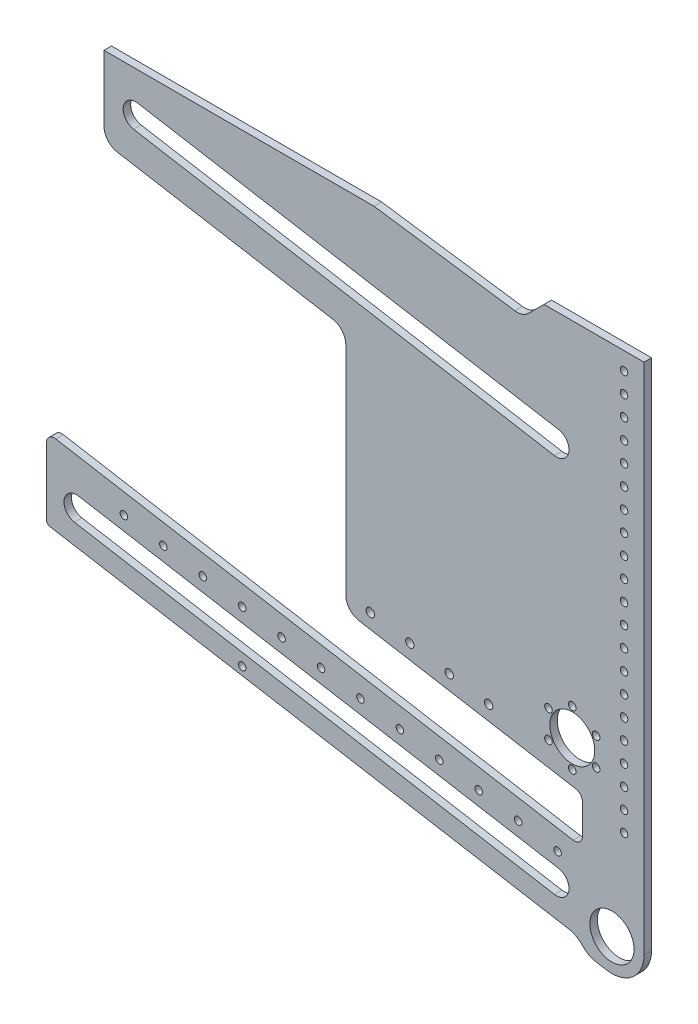
from build123d import *

# Parameters (mm, degrees)
SKETCH1_R           = 14.0335
SKETCH1_R_2         = 2.38125
SKETCH1_R_3         = 14.2875
SKETCH1_R_4         = 2.413
SKETCH1_R_5         = 2.667
SKETCH1_R_6         = 2.3876
BOSS_EXTRUDE1_DEPTH = 4.7625
CUT_EXTRUDE1_DEPTH  = 384.716655604


with BuildPart() as part:
    # Sketch1 → Boss-Extrude1 (new body)
    with BuildSketch(Plane.XY):
        with BuildLine():
            Line((165.542350471, -12.850928795), (158.864493489, -11.70515089))
            ThreePointArc((158.864493489, -11.70515089), (154.154566121, -10.06953751), (150.224583517, -7.001332225))
            ThreePointArc((150.224583517, -7.001332225), (146.294597206, -3.933124046), (141.584665397, -2.297509122))
            Line((141.584665397, -2.297509122), (-187.947182678, 54.243131298))
            ThreePointArc((-187.947182678, 54.243131298), (-189.459634879, 55.109389206), (-190.057649529, 56.746549217))
            Line((-190.057649529, 56.746549217), (-190.057649529, 99.332130912))
            ThreePointArc((-190.057649529, 99.332130912), (-188.265613802, 103.186753181), (-184.163460571, 104.301133618))
            Line((-184.163460571, 104.301133618), (139.126757829, 48.831423795))
            Line((139.126757829, 48.831423795), (144.285517219, 47.946290654))
            ThreePointArc((144.285517219, 47.946290654), (148.418903539, 49.069155791), (150.224583517, 52.953126491))
            Line((150.224583517, 52.953126491), (150.224583517, 72.003126491))
            ThreePointArc((150.224583517, 72.003126491), (149.028554217, 75.277446512), (146.003649815, 77.009962327))
            Line((146.003649815, 77.009962327), (8.4682776, 100.608100325))
            ThreePointArc((8.4682776, 100.608100325), (2.418468796, 104.073131956), (0.026410195, 110.621771999))
            Line((0.026410195, 110.621771999), (0.026410195, 248.086676381))
            ThreePointArc((0.026410195, 248.086676381), (-2.365648405, 254.635316424), (-8.41545721, 258.100348054))
            Line((-8.41545721, 258.100348054), (-145.085278605, 281.549975983))
            ThreePointArc((-145.085278605, 281.549975983), (-151.135087409, 285.015007613), (-153.52714601, 291.563647656))
            Line((-153.52714601, 291.563647656), (-153.52714601, 333.30748602))
            Line((-153.52714601, 333.30748602), (189.37285399, 333.30748602))
            Line((189.37285399, 333.30748602), (189.37285399, 131.560051298))
            Line((189.37285399, 131.560051298), (189.37285399, 7.239))
            ThreePointArc((189.37285399, 7.239), (182.127563077, -8.345432433), (165.542350471, -12.850928795))
        make_face()
        with Locations((168.98935399, 7.239)):
            Circle(SKETCH1_R, mode=Mode.SUBTRACT)
        with Locations((176.67285399, 118.860051298)):
            Circle(SKETCH1_R_2, mode=Mode.SUBTRACT)
        with Locations((176.67285399, 106.160051298)):
            Circle(SKETCH1_R_2, mode=Mode.SUBTRACT)
        with Locations((176.67285399, 93.460051298)):
            Circle(SKETCH1_R_2, mode=Mode.SUBTRACT)
        with Locations((176.67285399, 80.760051298)):
            Circle(SKETCH1_R_2, mode=Mode.SUBTRACT)
        with Locations((176.67285399, 68.060051298)):
            Circle(SKETCH1_R_2, mode=Mode.SUBTRACT)
        with Locations((109.44968796, 41.130584726)):
            Circle(SKETCH1_R_2, mode=Mode.SUBTRACT)
        with Locations((84.415508776, 45.425916214)):
            Circle(SKETCH1_R_2, mode=Mode.SUBTRACT)
        with Locations((59.381329592, 49.721247702)):
            Circle(SKETCH1_R_2, mode=Mode.SUBTRACT)
        with Locations((34.347150409, 54.016579191)):
            Circle(SKETCH1_R_2, mode=Mode.SUBTRACT)
        with Locations((9.312971225, 58.311910679)):
            Circle(SKETCH1_R_2, mode=Mode.SUBTRACT)
        with Locations((-15.721207959, 62.607242167)):
            Circle(SKETCH1_R_2, mode=Mode.SUBTRACT)
        with Locations((-40.755387143, 66.902573656)):
            Circle(SKETCH1_R_2, mode=Mode.SUBTRACT)
        with Locations((-65.789566327, 71.197905144)):
            Circle(SKETCH1_R_2, mode=Mode.SUBTRACT)
        with Locations((-90.82374551, 75.493236632)):
            Circle(SKETCH1_R_2, mode=Mode.SUBTRACT)
        with Locations((-115.857924694, 79.788568121)):
            Circle(SKETCH1_R_2, mode=Mode.SUBTRACT)
        with Locations((-140.892103878, 84.083899609)):
            Circle(SKETCH1_R_2, mode=Mode.SUBTRACT)
        with Locations((134.483867144, 36.835253237)):
            Circle(SKETCH1_R_2, mode=Mode.SUBTRACT)
        with Locations((143.80981943, 103.921008836)):
            Circle(SKETCH1_R_3, mode=Mode.SUBTRACT)
        with Locations((143.80981943, 121.383508836)):
            Circle(SKETCH1_R_4, mode=Mode.SUBTRACT)
        with Locations((158.932788044, 112.652258836)):
            Circle(SKETCH1_R_4, mode=Mode.SUBTRACT)
        with Locations((158.932788044, 95.189758836)):
            Circle(SKETCH1_R_4, mode=Mode.SUBTRACT)
        with Locations((143.80981943, 86.458508836)):
            Circle(SKETCH1_R_4, mode=Mode.SUBTRACT)
        with Locations((128.686850817, 95.189758836)):
            Circle(SKETCH1_R_4, mode=Mode.SUBTRACT)
        with Locations((128.686850817, 112.652258836)):
            Circle(SKETCH1_R_4, mode=Mode.SUBTRACT)
        with Locations((176.67285399, 131.560051298)):
            Circle(SKETCH1_R_2, mode=Mode.SUBTRACT)
        with Locations((176.67285399, 144.260051298)):
            Circle(SKETCH1_R_2, mode=Mode.SUBTRACT)
        with Locations((176.67285399, 156.960051298)):
            Circle(SKETCH1_R_2, mode=Mode.SUBTRACT)
        with Locations((176.67285399, 169.660051298)):
            Circle(SKETCH1_R_2, mode=Mode.SUBTRACT)
        with Locations((176.67285399, 182.360051298)):
            Circle(SKETCH1_R_2, mode=Mode.SUBTRACT)
        with Locations((176.67285399, 195.060051298)):
            Circle(SKETCH1_R_2, mode=Mode.SUBTRACT)
        with Locations((176.67285399, 207.760051298)):
            Circle(SKETCH1_R_2, mode=Mode.SUBTRACT)
        with Locations((176.67285399, 220.460051298)):
            Circle(SKETCH1_R_2, mode=Mode.SUBTRACT)
        with Locations((176.67285399, 233.160051298)):
            Circle(SKETCH1_R_2, mode=Mode.SUBTRACT)
        with Locations((176.67285399, 245.860051298)):
            Circle(SKETCH1_R_2, mode=Mode.SUBTRACT)
        with Locations((176.67285399, 258.560051298)):
            Circle(SKETCH1_R_2, mode=Mode.SUBTRACT)
        with Locations((176.67285399, 271.260051298)):
            Circle(SKETCH1_R_2, mode=Mode.SUBTRACT)
        with Locations((176.67285399, 283.960051298)):
            Circle(SKETCH1_R_2, mode=Mode.SUBTRACT)
        with Locations((176.67285399, 296.660051298)):
            Circle(SKETCH1_R_2, mode=Mode.SUBTRACT)
        with Locations((176.67285399, 309.360051298)):
            Circle(SKETCH1_R_2, mode=Mode.SUBTRACT)
        with Locations((176.67285399, 322.060051298)):
            Circle(SKETCH1_R_2, mode=Mode.SUBTRACT)
        with Locations((15.601656952, 108.723696433)):
            Circle(SKETCH1_R_5, mode=Mode.SUBTRACT)
        with Locations((40.636049132, 104.429606517)):
            Circle(SKETCH1_R_5, mode=Mode.SUBTRACT)
        with Locations((65.670441311, 100.135516602)):
            Circle(SKETCH1_R_5, mode=Mode.SUBTRACT)
        with Locations((90.704833491, 95.841426686)):
            Circle(SKETCH1_R_5, mode=Mode.SUBTRACT)
        with Locations((-65.789566327, 38.50103382)):
            Circle(SKETCH1_R_6, mode=Mode.SUBTRACT)
        with BuildLine():
            Line((132.450059381, 12.155377797), (-172.349940619, 64.452560302))
            ThreePointArc((-172.349940619, 64.452560302), (-178.830830524, 73.618032387), (-169.665358439, 80.098922292))
            Line((-169.665358439, 80.098922292), (135.134641561, 27.801739787))
            ThreePointArc((135.134641561, 27.801739787), (141.615531466, 18.636267702), (132.450059381, 12.155377797))
        make_face(mode=Mode.SUBTRACT)
        with BuildLine():
            Line((132.450059381, 253.455377797), (-134.757940619, 299.30257446))
            ThreePointArc((-134.757940619, 299.30257446), (-141.238830524, 308.468046545), (-132.073358439, 314.94893645))
            Line((-132.073358439, 314.94893645), (135.134641561, 269.101739787))
            ThreePointArc((135.134641561, 269.101739787), (141.615531466, 259.936267702), (132.450059381, 253.455377797))
        make_face(mode=Mode.SUBTRACT)
    extrude(amount=BOSS_EXTRUDE1_DEPTH)

    # Sketch3 → Cut-Extrude1 (cut, through all)
    with BuildSketch(Plane.XY.offset(4.7625)):
        with BuildLine():
            Line((125.87285399, 333.30748602), (115.993328583, 323.427960612))
            ThreePointArc((115.993328583, 323.427960612), (112.023332702, 320.973988275), (107.375068785, 320.553881036))
            Line((107.375068785, 320.553881036), (17.92285399, 333.30748602))
            Line((17.92285399, 333.30748602), (125.87285399, 333.30748602))
        make_face()
    extrude(amount=-CUT_EXTRUDE1_DEPTH, mode=Mode.SUBTRACT)


solid = part.part
